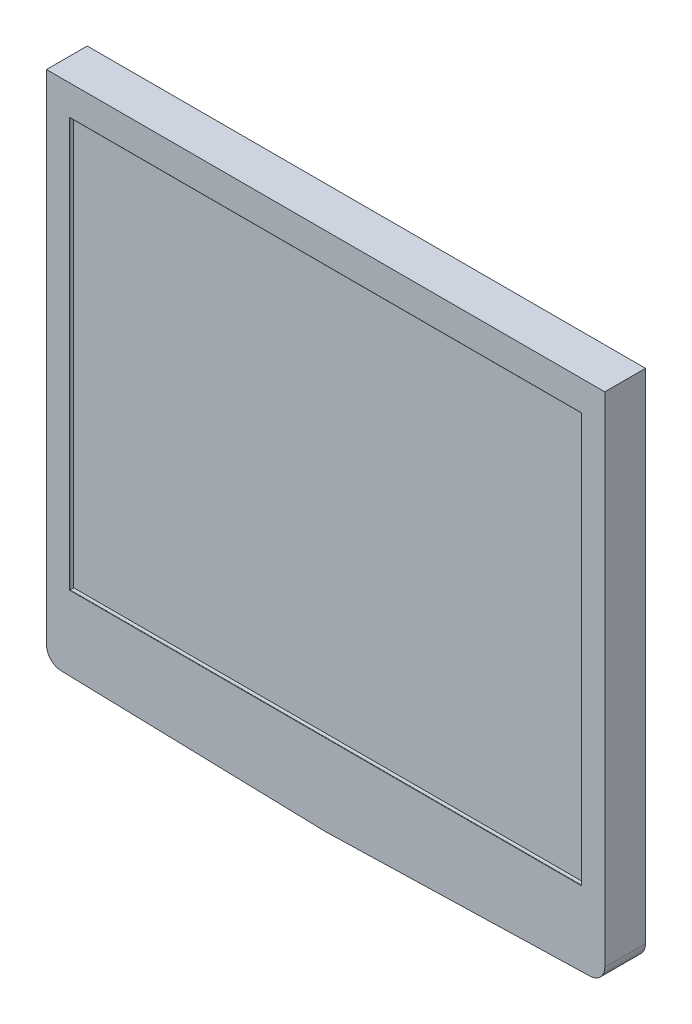
from build123d import *
from OCP.BRepFilletAPI import BRepFilletAPI_MakeChamfer

# Parameters (mm, degrees)
BOSS_EXTRUDE1_DEPTH     = 27
SKETCH2_W               = 339
SKETCH2_H               = 271
CUT_EXTRUDE1_DEPTH      = 2.54
FILLET2_R               = 0.254
ESQUISSE1_W             = 314
ESQUISSE1_H             = 295.992698065
BOSS_EXTRU_1_DEPTH      = 25
CHANFREIN1_SIZE         = 25
CHANFREIN1_SIZE_2       = 35
ENL_V_MAT_EXTRU_1_DEPTH = 25
ESQUISSE3_R             = 2.5
ENL_V_MAT_EXTRU_2_DEPTH = 15


with BuildPart() as part:
    # Sketch1 → Boss-Extrude1 (new body)
    with BuildSketch(Plane.XY):
        with BuildLine():
            Line((9.729828387, -0.262968335), (184.729828387, -4.992698065))
            ThreePointArc((184.729828387, -4.992698065), (185, -4.996348366), (185.270171613, -4.992698065))
            Line((185.270171613, -4.992698065), (360.270171613, -0.262968335))
            ThreePointArc((360.270171613, -0.262968335), (367.165951302, 2.758487678), (370, 9.733381364))
            Line((370, 9.733381364), (370, 340))
            Line((370, 340), (0, 340))
            Line((0, 340), (0, 9.733381364))
            ThreePointArc((0, 9.733381364), (2.834048698, 2.758487678), (9.729828387, -0.262968335))
        make_face()
    extrude(amount=BOSS_EXTRUDE1_DEPTH)

    # Sketch2 → Cut-Extrude1 (cut)
    with BuildSketch(Plane.XY.offset(27)):
        with Locations((185, 184.5)):
            Rectangle(SKETCH2_W, SKETCH2_H)
    extrude(amount=-CUT_EXTRUDE1_DEPTH, mode=Mode.SUBTRACT)

    # Fillet2
    fillet2_edges = [part.edges().sort_by_distance(p)[0] for p in [
        (354.5, 184.5, 24.46),
        (15.5, 184.5, 27),
        (185, 49, 27),
        (185, 320, 27),
    ]]
    fillet(fillet2_edges, radius=FILLET2_R)

    # Esquisse1 → Boss.-Extru.1 (add)
    with BuildSketch(Plane(origin=(0, 0, 0), x_dir=(-1, 0, 0), z_dir=(0, 0, -1))):
        with Locations((-185, 155.003650967)):
            Rectangle(ESQUISSE1_W, ESQUISSE1_H)
    extrude(amount=BOSS_EXTRU_1_DEPTH)

    # Chanfrein1
    chanfrein1_edges_1 = [part.edges().sort_by_distance(p)[0] for p in [
        (28, 155.003650968, -25),
    ]]
    chanfrein1_side_1 = [part.faces().sort_by_distance(p)[0] for p in [
        (28, 155.003650968, -24.5),
    ]]
    chanfrein1_edges_2 = [part.edges().sort_by_distance(p)[0] for p in [
        (185, 303, -25),
    ]]
    chanfrein1_side_2 = [part.faces().sort_by_distance(p)[0] for p in [
        (185, 303, -24.5),
    ]]
    chanfrein1_edges_3 = [part.edges().sort_by_distance(p)[0] for p in [
        (342, 155.003650968, -25),
    ]]
    chanfrein1_side_3 = [part.faces().sort_by_distance(p)[0] for p in [
        (342, 155.003650968, -24.5),
    ]]
    chanfrein1 = BRepFilletAPI_MakeChamfer(part.part.solid().wrapped)
    for e in chanfrein1_edges_1:
        chanfrein1.Add(CHANFREIN1_SIZE - 0.0001, CHANFREIN1_SIZE_2 - 0.0001, e.wrapped, chanfrein1_side_1[0].wrapped)
    for e in chanfrein1_edges_2:
        chanfrein1.Add(CHANFREIN1_SIZE - 0.0001, CHANFREIN1_SIZE_2 - 0.0001, e.wrapped, chanfrein1_side_2[0].wrapped)
    for e in chanfrein1_edges_3:
        chanfrein1.Add(CHANFREIN1_SIZE - 0.0001, CHANFREIN1_SIZE_2 - 0.0001, e.wrapped, chanfrein1_side_3[0].wrapped)
    add(Compound.cast(chanfrein1.Shape()), mode=Mode.REPLACE)  # a hair under: the kernel refuses the full size

    # Esquisse2 → Enlèv. mat.-Extru.1 (cut)
    with BuildSketch(Plane(origin=(0, 0, -25), x_dir=(-1, 0, 0), z_dir=(0, 0, -1))):
        Polygon((-273.063305356, 7.007301935), (-89.826670404, 7.007301935), (-89.826670404, 60.007301935), (-66.826670404, 60.007301935), (-66.826670404, 108.007301935), (-296.063305356, 108.007301935), (-296.063305356, 60.007301935), (-273.063305356, 60.007301935), align=None)
    extrude(amount=-ENL_V_MAT_EXTRU_1_DEPTH, mode=Mode.SUBTRACT)

    # Esquisse3 → Enlèv. mat.-Extru.2 (cut)
    with BuildSketch(Plane(origin=(0, 0, -25), x_dir=(-1, 0, 0), z_dir=(0, 0, -1))):
        with Locations((-188, 255.8)):
            Circle(ESQUISSE3_R)
        with Locations((-238, 193)):
            Circle(ESQUISSE3_R)
        with Locations((-132, 193)):
            Circle(ESQUISSE3_R)
    extrude(amount=-ENL_V_MAT_EXTRU_2_DEPTH, mode=Mode.SUBTRACT)


solid = part.part
